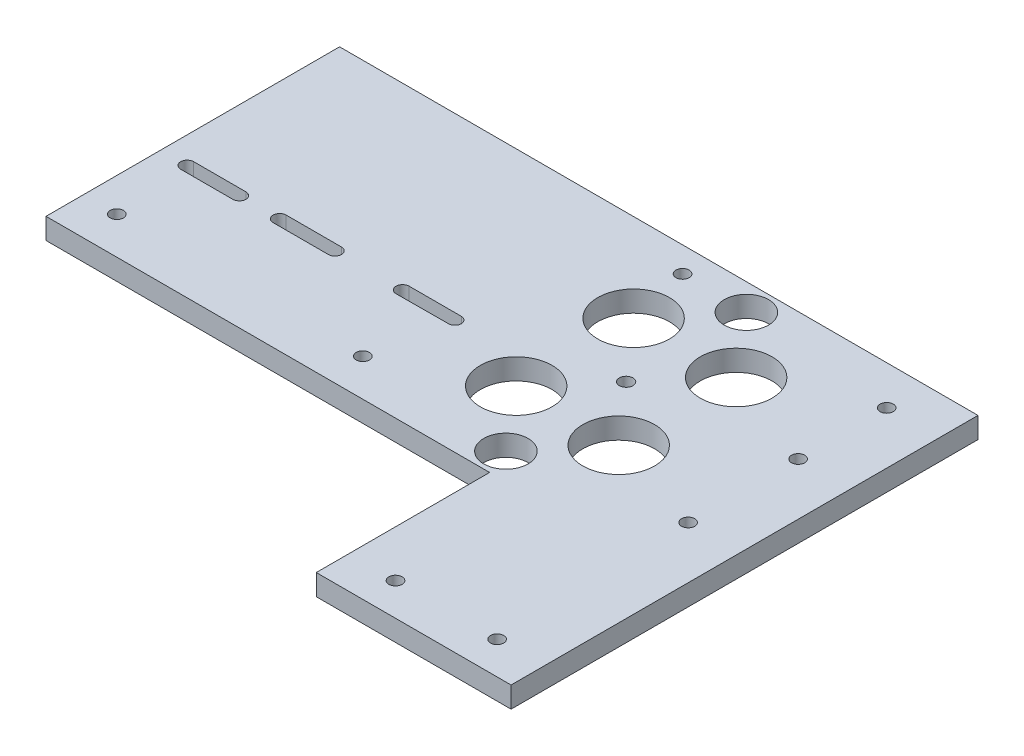
from build123d import *

# Parameters (mm, degrees)
SKETCH1_W                = 88.9
SKETCH1_H                = 80.01
SKETCH1_R                = 9.779
SKETCH1_R_2              = 6.0325
SKETCH1_W_2              = 73.66
SKETCH1_W_3              = 11.43
BOSS_EXTRUDE1_DEPTH      = 5.715
M3_CLEARANCE_HOLE1_D     = 3.6
M3_CLEARANCE_HOLE1_DEPTH = 25.4
M3_CLEARANCE_HOLE1_TIP   = 1.081549114
M3_CLEARANCE_HOLE2_D     = 3.7
M3_CLEARANCE_HOLE2_DEPTH = 25.4
M3_CLEARANCE_HOLE2_TIP   = 1.111592145
CUT_EXTRUDE1_START       = -5.715
CUT_EXTRUDE1_DEPTH       = 5.715


# Read off the part's stored shape, not the designer's step: Cut-Extrude1
with BuildPart() as part:
    # Sketch1 → Boss-Extrude1 (new body)
    # profile 1 of 4: a face of its own
    with BuildSketch(Plane(origin=(0, 0, 0), x_dir=(1, 0, 0), z_dir=(0, 1, 0))):
        Rectangle(SKETCH1_W, SKETCH1_H)
        with Locations(Location((-13.97, -16.002, 0), (0, 0, 270))):
            Circle(SKETCH1_R, mode=Mode.SUBTRACT)
        with Locations(Location((13.97, -16.002, 0), (0, 0, 270))):
            Circle(SKETCH1_R, mode=Mode.SUBTRACT)
        with Locations(Location((-13.97, 16.002, 0), (0, 0, 270))):
            Circle(SKETCH1_R, mode=Mode.SUBTRACT)
        with Locations(Location((13.97, 16.002, 0), (0, 0, 270))):
            Circle(SKETCH1_R, mode=Mode.SUBTRACT)
        with Locations(Location((0, 32.766, 0), (0, 0, 270))):
            Circle(SKETCH1_R_2, mode=Mode.SUBTRACT)
        with Locations(Location((0, -32.766, 0), (0, 0, 270))):
            Circle(SKETCH1_R_2, mode=Mode.SUBTRACT)
    # profile 2 of 4: a face of its own
    with BuildSketch(Plane(origin=(0, 0, 0), x_dir=(1, 0, 0), z_dir=(0, 1, 0))):
        with Locations((-81.28, 0)):
            Rectangle(SKETCH1_W_2, SKETCH1_H)
    # profile 3 of 4: a face of its own
    with BuildSketch(Plane(origin=(0, 0, 0), x_dir=(1, 0, 0), z_dir=(0, 1, 0))):
        with Locations((50.165, 0)):
            Rectangle(SKETCH1_W_3, SKETCH1_H)
    # profile 4 of 4: a face of its own
    with BuildSketch(Plane(origin=(0, 0, 0), x_dir=(1, 0, 0), z_dir=(0, 1, 0))):
        Polygon((55.88, -40.005), (44.45, -40.005), (2.794, -40.005), (2.794, -87.249), (55.88, -87.249), align=None)
    extrude(amount=BOSS_EXTRUDE1_DEPTH)

    # M3 Clearance Hole1
    with Locations(Plane(origin=(0, 5.715, 0), x_dir=(1, 0, 0), z_dir=(0, 1, 0))):
        with Locations((-17.78, 33.147), (41.656, 29.337), (41.656, 5.207), (41.656, -24.765), (43.18, -78.359), (15.494, -78.359), (-41.91, -29.845), (-108.966, -29.845)):
            Hole(M3_CLEARANCE_HOLE1_D / 2, depth=M3_CLEARANCE_HOLE1_DEPTH)
            with Locations((0, 0, -(M3_CLEARANCE_HOLE1_DEPTH + M3_CLEARANCE_HOLE1_TIP / 2))):  # 118° drill point
                Cone(0, M3_CLEARANCE_HOLE1_D / 2, M3_CLEARANCE_HOLE1_TIP, mode=Mode.SUBTRACT)

    # M3 Clearance Hole2
    with Locations(Plane(origin=(0, 5.715, 0), x_dir=(1, 0, 0), z_dir=(0, 1, 0))):
        with Locations((0, 0)):
            Hole(M3_CLEARANCE_HOLE2_D / 2, depth=M3_CLEARANCE_HOLE2_DEPTH)
            with Locations((0, 0, -(M3_CLEARANCE_HOLE2_DEPTH + M3_CLEARANCE_HOLE2_TIP / 2))):  # 118° drill point
                Cone(0, M3_CLEARANCE_HOLE2_D / 2, M3_CLEARANCE_HOLE2_TIP, mode=Mode.SUBTRACT)

    # Cut-Extrude1 outline → Cut-Extrude1 (cut)
    with BuildSketch(Plane(origin=(0, 5.715, 0), x_dir=(1, 0, 0), z_dir=(0, 1, 0)).offset(CUT_EXTRUDE1_START)):
        with BuildLine():
            Line((-52.137072336, -10.588243938), (-37.913072336, -10.513831599))
            ThreePointArc((-37.913072336, -10.513831599), (-36.162240737, -8.763), (-37.913072336, -7.012168401))
            Line((-37.913072336, -7.012168401), (-52.137072336, -7.012168401))
            ThreePointArc((-52.137072336, -7.012168401), (-53.925110105, -8.80020617), (-52.137072336, -10.588243938))
        make_face()
        with BuildLine():
            Line((-110.876944468, -10.539089177), (-96.652944596, -10.541))
            ThreePointArc((-96.652944596, -10.541), (-94.874944596, -8.763), (-96.652944596, -6.985))
            Line((-96.652944596, -6.985), (-110.876944468, -6.983089177))
            ThreePointArc((-110.876944468, -6.983089177), (-112.654944468, -8.761089177), (-110.876944468, -10.539089177))
        make_face()
        with BuildLine():
            ThreePointArc((-85.680129902, -6.983089177), (-87.460040724, -8.763), (-85.680129902, -10.542910823))
            Line((-85.680129902, -10.542910823), (-70.60161816, -10.542910823))
            ThreePointArc((-70.60161816, -10.542910823), (-68.821707338, -8.763), (-70.60161816, -6.983089177))
            Line((-70.60161816, -6.983089177), (-85.680129902, -6.983089177))
        make_face()
    extrude(amount=CUT_EXTRUDE1_DEPTH, mode=Mode.SUBTRACT)


solid = part.part
